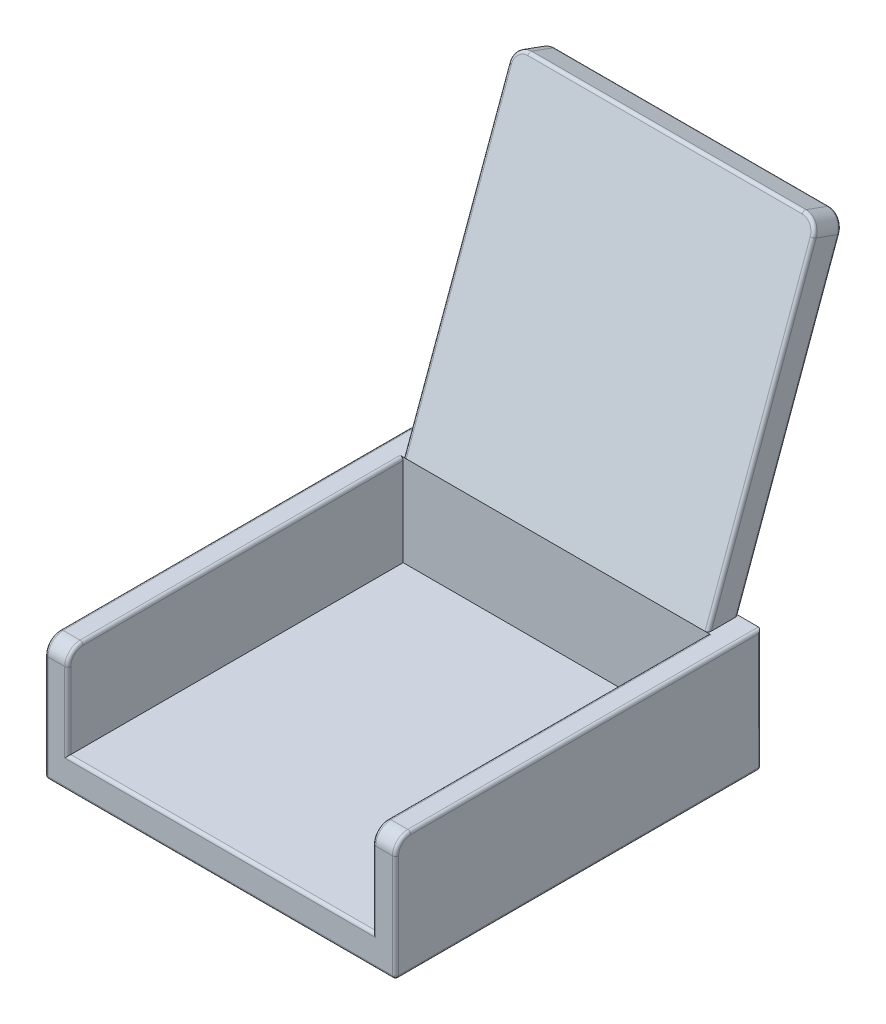
from build123d import *

# Parameters (mm, degrees)
SKETCH_1_W           = 23
SKETCH_1_H           = 24
EXTRUDE_1_DEPTH      = 8
SKETCH_2_W           = 20
SKETCH_2_H           = 22
CUT_EXTRUDE_1_DEPTH  = 6
EXTRUDE_3_DEPTH      = 10
EXTRUDE_3_DEPTH_BACK = 10
EXTRUDE_START        = -3.5
EXTRUDE_4_DEPTH      = 15
FILLET_1_R           = 1
FILLET_3_R           = 0.2
FILLET_4_R           = 0.2
FILLET_6_R           = 0.1


with BuildPart() as part:
    # 草图1 → 凸台-拉伸1 (new body)
    with BuildSketch(Plane(origin=(0, 0, 0), x_dir=(1, 0, 0), z_dir=(0, 1, 0))):
        Rectangle(SKETCH_1_W, SKETCH_1_H)
    extrude(amount=EXTRUDE_1_DEPTH)

    # 草图2 → 切除-拉伸1 (cut)
    with BuildSketch(Plane(origin=(0, 8, 0), x_dir=(1, 0, 0), z_dir=(0, 1, 0))):
        with Locations((0, -1)):
            Rectangle(SKETCH_2_W, SKETCH_2_H)
    extrude(amount=-CUT_EXTRUDE_1_DEPTH, mode=Mode.SUBTRACT)

    # 草图3 → 凸台-拉伸3 (add, two sides: drawn at the far end of the back side and taken through both)
    with BuildSketch(Plane(origin=(0, 0, 0), x_dir=(0, 0, -1), z_dir=(1, 0, 0)).offset(-EXTRUDE_3_DEPTH_BACK)):
        Polygon((12, 8), (19.011412938, 27.263698726), (17.245368495, 27.906486336), (10, 8), align=None)
    extrude(amount=EXTRUDE_3_DEPTH + EXTRUDE_3_DEPTH_BACK)

    # 草图4 → 凸台-拉伸4 (add)
    with BuildSketch(Plane.XY.offset(12).offset(EXTRUDE_START)):
        with BuildLine():
            Line((-1.5, 0), (1.5, 0))
            Line((1.5, 0), (1.5, -0.677124344))
            ThreePointArc((1.5, -0.677124344), (1.780042303, -1.088161527), (1.95, -1.555590279))
            Line((1.95, -1.555590279), (1.95, -2.5))
            Line((1.95, -2.5), (1.466025404, -2.5))
            Line((1.466025404, -2.5), (0.6, -1))
            Line((0.6, -1), (-0.6, -1))
            Line((-0.6, -1), (-1.466025404, -2.5))
            Line((-1.466025404, -2.5), (-1.95, -2.5))
            Line((-1.95, -2.5), (-1.95, -1.555590279))
            ThreePointArc((-1.95, -1.555590279), (-1.780042303, -1.088161527), (-1.5, -0.677124344))
            Line((-1.5, -0.677124344), (-1.5, 0))
        make_face()
    extrude(amount=-EXTRUDE_4_DEPTH)

    # 圆角1
    fillet_1_edges = [part.edges().sort_by_distance(p)[0] for p in [
        (-10.75, 8, 12),
        (10.75, 8, 12),
        (-10, 27.585092531, -18.128390717),
        (10, 27.585092531, -18.128390717),
    ]]
    fillet(fillet_1_edges, radius=FILLET_1_R)

    # 圆角3
    # the kernel refuses this fillet: 0.2 mm, written as the material it takes off along each edge
    with BuildSketch(Plane(origin=(-11.3, 0.2, 11.8), x_dir=(0, -1, 0), z_dir=(0, 0, 1))) as fillet_3_piece_1_section:
        Polygon((0, 0), (FILLET_3_R * 1.02, 0), (FILLET_3_R * 1.02, -FILLET_3_R * 1.02), (0, -FILLET_3_R * 1.02), align=None)
    fillet_3_piece_1 = extrude(amount=FILLET_3_R * 1.02, mode=Mode.PRIVATE)
    fillet_3_piece_1 = fillet_3_piece_1 - Plane(origin=(-11.3, 0.2, 11.8), x_dir=(0.7071067811865475, 0.7071067811865475, 0), z_dir=(0, 0, 1)) * Sphere(FILLET_3_R, mode=Mode.PRIVATE)
    add(fillet_3_piece_1, mode=Mode.SUBTRACT)
    with BuildSketch(Plane(origin=(-11.3, 0.2, -11.8), x_dir=(0, 0, -1), z_dir=(0, -1, 0))) as fillet_3_piece_2_section:
        Polygon((0, 0), (FILLET_3_R * 1.02, 0), (FILLET_3_R * 1.02, -FILLET_3_R * 1.02), (0, -FILLET_3_R * 1.02), align=None)
    fillet_3_piece_2 = extrude(amount=FILLET_3_R * 1.02, mode=Mode.PRIVATE)
    fillet_3_piece_2 = fillet_3_piece_2 - Plane(origin=(-11.3, 0.2, -11.8), x_dir=(0.7071067811865477, 0, 0.7071067811865475), z_dir=(0, -1, 0)) * Sphere(FILLET_3_R, mode=Mode.PRIVATE)
    add(fillet_3_piece_2, mode=Mode.SUBTRACT)
    with BuildSketch(Plane(origin=(11.3, 0.2, -11.8), x_dir=(0, -1, 0), z_dir=(1, 0, 0))) as fillet_3_piece_3_section:
        Polygon((0, 0), (FILLET_3_R * 1.02, 0), (FILLET_3_R * 1.02, FILLET_3_R * 1.02), (0, FILLET_3_R * 1.02), align=None)
    fillet_3_piece_3 = extrude(amount=FILLET_3_R * 1.02, mode=Mode.PRIVATE)
    fillet_3_piece_3 = fillet_3_piece_3 - Plane(origin=(11.3, 0.2, -11.8), x_dir=(0, 0.7071067811865475, 0.7071067811865475), z_dir=(1, 0, 0)) * Sphere(FILLET_3_R, mode=Mode.PRIVATE)
    add(fillet_3_piece_3, mode=Mode.SUBTRACT)
    with BuildSketch(Plane(origin=(11.3, 0.2, 11.8), x_dir=(0, 0, 1), z_dir=(1, 0, 0))) as fillet_3_piece_4_section:
        Polygon((0, 0), (FILLET_3_R * 1.02, 0), (FILLET_3_R * 1.02, FILLET_3_R * 1.02), (0, FILLET_3_R * 1.02), align=None)
    fillet_3_piece_4 = extrude(amount=FILLET_3_R * 1.02, mode=Mode.PRIVATE)
    fillet_3_piece_4 = fillet_3_piece_4 - Plane(origin=(11.3, 0.2, 11.8), x_dir=(0, 0.7071067811865475, -0.7071067811865475), z_dir=(1, 0, 0)) * Sphere(FILLET_3_R, mode=Mode.PRIVATE)
    add(fillet_3_piece_4, mode=Mode.SUBTRACT)
    with BuildSketch(Plane(origin=(-10, 8, -10), x_dir=(0, -1, 0), z_dir=(0, 0, 1))) as fillet_3_piece_5_section:
        with BuildLine():
            CenterArc((FILLET_3_R, -FILLET_3_R), FILLET_3_R, 90, 90)
            Line((0, -FILLET_3_R), (-FILLET_3_R * 0.02, -FILLET_3_R))
            Line((-FILLET_3_R * 0.02, -FILLET_3_R), (-FILLET_3_R * 0.02, FILLET_3_R * 0.02))
            Line((-FILLET_3_R * 0.02, FILLET_3_R * 0.02), (FILLET_3_R, FILLET_3_R * 0.02))
            Line((FILLET_3_R, FILLET_3_R * 0.02), (FILLET_3_R, 0))
        make_face()
    fillet_3_piece_5 = extrude(amount=21, mode=Mode.PRIVATE)
    fillet_3_piece_5 = split(fillet_3_piece_5, bisect_by=Plane(origin=(-10, 7.959305374, 0.5), z_dir=(-1, 0, 0)), keep=Keep.TOP, mode=Mode.PRIVATE)
    add(fillet_3_piece_5, mode=Mode.SUBTRACT)
    with BuildSketch(Plane(origin=(-10, 7, 11), x_dir=(0, 0, 1), z_dir=(0, -1, 0))) as fillet_3_piece_6:
        with BuildLine():
            CenterArc((1 - FILLET_3_R, FILLET_3_R), FILLET_3_R, 270, 90)
            Line((1 - FILLET_3_R, 0), (1 - FILLET_3_R, -FILLET_3_R * 0.02))
            Line((1 - FILLET_3_R, -FILLET_3_R * 0.02), (1 + FILLET_3_R * 0.02, -FILLET_3_R * 0.02))
            Line((1 + FILLET_3_R * 0.02, -FILLET_3_R * 0.02), (1 + FILLET_3_R * 0.02, FILLET_3_R))
            Line((1 + FILLET_3_R * 0.02, FILLET_3_R), (1, FILLET_3_R))
        make_face()
    revolve(axis=Axis((-10, 7, 11), (-1, 0, 0)), revolution_arc=90, mode=Mode.SUBTRACT)
    with BuildSketch(Plane(origin=(10, 8, 11), x_dir=(1, 0, 0), z_dir=(0, 0, -1))) as fillet_3_piece_7_section:
        with BuildLine():
            CenterArc((FILLET_3_R, FILLET_3_R), FILLET_3_R, 180, 90)
            Line((0, FILLET_3_R), (-FILLET_3_R * 0.02, FILLET_3_R))
            Line((-FILLET_3_R * 0.02, FILLET_3_R), (-FILLET_3_R * 0.02, -FILLET_3_R * 0.02))
            Line((-FILLET_3_R * 0.02, -FILLET_3_R * 0.02), (FILLET_3_R, -FILLET_3_R * 0.02))
            Line((FILLET_3_R, -FILLET_3_R * 0.02), (FILLET_3_R, 0))
        make_face()
    fillet_3_piece_7 = extrude(amount=21, mode=Mode.PRIVATE)
    fillet_3_piece_7 = split(fillet_3_piece_7, bisect_by=Plane(origin=(10, 7.959305374, 0.5), z_dir=(1, 0, 0)), keep=Keep.TOP, mode=Mode.PRIVATE)
    add(fillet_3_piece_7, mode=Mode.SUBTRACT)
    with BuildSketch(Plane(origin=(10, 7, 11), x_dir=(0, 0, 1), z_dir=(0, -1, 0))) as fillet_3_piece_8:
        with BuildLine():
            CenterArc((1 - FILLET_3_R, -FILLET_3_R), FILLET_3_R, 0, 90)
            Line((1 - FILLET_3_R, 0), (1 - FILLET_3_R, FILLET_3_R * 0.02))
            Line((1 - FILLET_3_R, FILLET_3_R * 0.02), (1 + FILLET_3_R * 0.02, FILLET_3_R * 0.02))
            Line((1 + FILLET_3_R * 0.02, FILLET_3_R * 0.02), (1 + FILLET_3_R * 0.02, -FILLET_3_R))
            Line((1 + FILLET_3_R * 0.02, -FILLET_3_R), (1, -FILLET_3_R))
        make_face()
    revolve(axis=Axis((10, 7, 11), (-1, 0, 0)), revolution_arc=90, mode=Mode.SUBTRACT)
    with BuildSketch(Plane(origin=(-11.5, 0, 11.8), x_dir=(1, 0, 0), z_dir=(0, 0, -1))) as fillet_3_piece_9:
        with BuildLine():
            CenterArc((FILLET_3_R, -FILLET_3_R), FILLET_3_R, 90, 90)
            Line((0, -FILLET_3_R), (-FILLET_3_R * 0.02, -FILLET_3_R))
            Line((-FILLET_3_R * 0.02, -FILLET_3_R), (-FILLET_3_R * 0.02, FILLET_3_R * 0.02))
            Line((-FILLET_3_R * 0.02, FILLET_3_R * 0.02), (FILLET_3_R, FILLET_3_R * 0.02))
            Line((FILLET_3_R, FILLET_3_R * 0.02), (FILLET_3_R, 0))
        make_face()
    extrude(amount=23.6, mode=Mode.SUBTRACT)
    with BuildSketch(Plane(origin=(-11.5, 0.2, -12), x_dir=(1, 0, 0), z_dir=(0, 1, 0)), Plane(origin=(11.5, 0.2, -12), x_dir=(0, 0, 1), z_dir=(0, 1, 0))) as fillet_3_piece_10:
        with BuildLine():
            CenterArc((FILLET_3_R, -FILLET_3_R), FILLET_3_R, 90, 90)
            Line((0, -FILLET_3_R), (-FILLET_3_R * 0.02, -FILLET_3_R))
            Line((-FILLET_3_R * 0.02, -FILLET_3_R), (-FILLET_3_R * 0.02, FILLET_3_R * 0.02))
            Line((-FILLET_3_R * 0.02, FILLET_3_R * 0.02), (FILLET_3_R, FILLET_3_R * 0.02))
            Line((FILLET_3_R, FILLET_3_R * 0.02), (FILLET_3_R, 0))
        make_face()
    extrude(amount=7.8, mode=Mode.SUBTRACT)
    with BuildSketch(Plane(origin=(-11.5, 8, 11), x_dir=(0, -1, 0), z_dir=(0, 0, -1)), Plane(origin=(11.5, 8, -12), x_dir=(0, -1, 0), z_dir=(0, 0, 1))) as fillet_3_piece_11:
        with BuildLine():
            CenterArc((FILLET_3_R, -FILLET_3_R), FILLET_3_R, 90, 90)
            Line((0, -FILLET_3_R), (-FILLET_3_R * 0.02, -FILLET_3_R))
            Line((-FILLET_3_R * 0.02, -FILLET_3_R), (-FILLET_3_R * 0.02, FILLET_3_R * 0.02))
            Line((-FILLET_3_R * 0.02, FILLET_3_R * 0.02), (FILLET_3_R, FILLET_3_R * 0.02))
            Line((FILLET_3_R, FILLET_3_R * 0.02), (FILLET_3_R, 0))
        make_face()
    extrude(amount=23, mode=Mode.SUBTRACT)
    with BuildSketch(Plane(origin=(-11.5, 7, 11), x_dir=(0, 0, 1), z_dir=(0, -1, 0))) as fillet_3_piece_12:
        with BuildLine():
            CenterArc((1 - FILLET_3_R, -FILLET_3_R), FILLET_3_R, 0, 90)
            Line((1, -FILLET_3_R), (1 + FILLET_3_R * 0.02, -FILLET_3_R))
            Line((1 + FILLET_3_R * 0.02, -FILLET_3_R), (1 + FILLET_3_R * 0.02, FILLET_3_R * 0.02))
            Line((1 + FILLET_3_R * 0.02, FILLET_3_R * 0.02), (1 - FILLET_3_R, FILLET_3_R * 0.02))
            Line((1 - FILLET_3_R, FILLET_3_R * 0.02), (1 - FILLET_3_R, 0))
        make_face()
    revolve(axis=Axis((-11.5, 7, 11), (-1, 0, 0)), revolution_arc=90, mode=Mode.SUBTRACT)
    with BuildSketch(Plane(origin=(11.5, 0, -11.8), x_dir=(0, 1, 0), z_dir=(0, 0, 1))) as fillet_3_piece_13:
        with BuildLine():
            CenterArc((FILLET_3_R, FILLET_3_R), FILLET_3_R, 180, 90)
            Line((0, FILLET_3_R), (-FILLET_3_R * 0.02, FILLET_3_R))
            Line((-FILLET_3_R * 0.02, FILLET_3_R), (-FILLET_3_R * 0.02, -FILLET_3_R * 0.02))
            Line((-FILLET_3_R * 0.02, -FILLET_3_R * 0.02), (FILLET_3_R, -FILLET_3_R * 0.02))
            Line((FILLET_3_R, -FILLET_3_R * 0.02), (FILLET_3_R, 0))
        make_face()
    extrude(amount=23.6, mode=Mode.SUBTRACT)
    with BuildSketch(Plane(origin=(11.5, 7, 11), x_dir=(0, 0, 1), z_dir=(0, -1, 0))) as fillet_3_piece_14:
        with BuildLine():
            CenterArc((1 - FILLET_3_R, FILLET_3_R), FILLET_3_R, 270, 90)
            Line((1, FILLET_3_R), (1 + FILLET_3_R * 0.02, FILLET_3_R))
            Line((1 + FILLET_3_R * 0.02, FILLET_3_R), (1 + FILLET_3_R * 0.02, -FILLET_3_R * 0.02))
            Line((1 + FILLET_3_R * 0.02, -FILLET_3_R * 0.02), (1 - FILLET_3_R, -FILLET_3_R * 0.02))
            Line((1 - FILLET_3_R, -FILLET_3_R * 0.02), (1 - FILLET_3_R, 0))
        make_face()
    revolve(axis=Axis((11.5, 7, 11), (-1, 0, 0)), revolution_arc=90, mode=Mode.SUBTRACT)
    with BuildSketch(Plane(origin=(11.3, 0, 12), x_dir=(0, 1, 0), z_dir=(-1, 0, 0))) as fillet_3_piece_15:
        with BuildLine():
            CenterArc((FILLET_3_R, FILLET_3_R), FILLET_3_R, 180, 90)
            Line((0, FILLET_3_R), (-FILLET_3_R * 0.02, FILLET_3_R))
            Line((-FILLET_3_R * 0.02, FILLET_3_R), (-FILLET_3_R * 0.02, -FILLET_3_R * 0.02))
            Line((-FILLET_3_R * 0.02, -FILLET_3_R * 0.02), (FILLET_3_R, -FILLET_3_R * 0.02))
            Line((FILLET_3_R, -FILLET_3_R * 0.02), (FILLET_3_R, 0))
        make_face()
    extrude(amount=22.6, mode=Mode.SUBTRACT)
    with BuildSketch(Plane(origin=(-11.5, 0.2, 12), x_dir=(1, 0, 0), z_dir=(0, 1, 0)), Plane(origin=(11.5, 0.2, 12), x_dir=(0, 0, -1), z_dir=(0, 1, 0))) as fillet_3_piece_16:
        with BuildLine():
            CenterArc((FILLET_3_R, FILLET_3_R), FILLET_3_R, 180, 90)
            Line((0, FILLET_3_R), (-FILLET_3_R * 0.02, FILLET_3_R))
            Line((-FILLET_3_R * 0.02, FILLET_3_R), (-FILLET_3_R * 0.02, -FILLET_3_R * 0.02))
            Line((-FILLET_3_R * 0.02, -FILLET_3_R * 0.02), (FILLET_3_R, -FILLET_3_R * 0.02))
            Line((FILLET_3_R, -FILLET_3_R * 0.02), (FILLET_3_R, 0))
        make_face()
    extrude(amount=6.8, mode=Mode.SUBTRACT)
    with BuildSketch(Plane(origin=(-10, 7, 12), x_dir=(-1, 0, 0), z_dir=(0, -1, 0))) as fillet_3_piece_17:
        with BuildLine():
            CenterArc((FILLET_3_R, FILLET_3_R), FILLET_3_R, 180, 90)
            Line((0, FILLET_3_R), (-FILLET_3_R * 0.02, FILLET_3_R))
            Line((-FILLET_3_R * 0.02, FILLET_3_R), (-FILLET_3_R * 0.02, -FILLET_3_R * 0.02))
            Line((-FILLET_3_R * 0.02, -FILLET_3_R * 0.02), (FILLET_3_R, -FILLET_3_R * 0.02))
            Line((FILLET_3_R, -FILLET_3_R * 0.02), (FILLET_3_R, 0))
        make_face()
    extrude(amount=5, mode=Mode.SUBTRACT)
    with BuildSketch(Plane(origin=(-10, 2, 12), x_dir=(0, -1, 0), z_dir=(1, 0, 0))) as fillet_3_piece_18:
        with BuildLine():
            CenterArc((FILLET_3_R, FILLET_3_R), FILLET_3_R, 180, 90)
            Line((0, FILLET_3_R), (-FILLET_3_R * 0.02, FILLET_3_R))
            Line((-FILLET_3_R * 0.02, FILLET_3_R), (-FILLET_3_R * 0.02, -FILLET_3_R * 0.02))
            Line((-FILLET_3_R * 0.02, -FILLET_3_R * 0.02), (FILLET_3_R, -FILLET_3_R * 0.02))
            Line((FILLET_3_R, -FILLET_3_R * 0.02), (FILLET_3_R, 0))
        make_face()
    extrude(amount=20, mode=Mode.SUBTRACT)
    with BuildSketch(Plane(origin=(10, 7, 12), x_dir=(1, 0, 0), z_dir=(0, -1, 0))) as fillet_3_piece_19:
        with BuildLine():
            CenterArc((FILLET_3_R, -FILLET_3_R), FILLET_3_R, 90, 90)
            Line((0, -FILLET_3_R), (-FILLET_3_R * 0.02, -FILLET_3_R))
            Line((-FILLET_3_R * 0.02, -FILLET_3_R), (-FILLET_3_R * 0.02, FILLET_3_R * 0.02))
            Line((-FILLET_3_R * 0.02, FILLET_3_R * 0.02), (FILLET_3_R, FILLET_3_R * 0.02))
            Line((FILLET_3_R, FILLET_3_R * 0.02), (FILLET_3_R, 0))
        make_face()
    extrude(amount=5, mode=Mode.SUBTRACT)
    with BuildSketch(Plane(origin=(-11.3, 0, -12), x_dir=(0, 0, 1), z_dir=(1, 0, 0))) as fillet_3_piece_20:
        with BuildLine():
            CenterArc((FILLET_3_R, -FILLET_3_R), FILLET_3_R, 90, 90)
            Line((0, -FILLET_3_R), (-FILLET_3_R * 0.02, -FILLET_3_R))
            Line((-FILLET_3_R * 0.02, -FILLET_3_R), (-FILLET_3_R * 0.02, FILLET_3_R * 0.02))
            Line((-FILLET_3_R * 0.02, FILLET_3_R * 0.02), (FILLET_3_R, FILLET_3_R * 0.02))
            Line((FILLET_3_R, FILLET_3_R * 0.02), (FILLET_3_R, 0))
        make_face()
    extrude(amount=22.6, mode=Mode.SUBTRACT)
    with BuildSketch(Plane(origin=(-11.5, 0.2, -12), x_dir=(1, 0, 0), z_dir=(0, 1, 0))) as fillet_3_piece_21a_section:
        with BuildLine():
            CenterArc((FILLET_3_R, -FILLET_3_R), FILLET_3_R, 90, 90)
            Line((0, -FILLET_3_R), (-FILLET_3_R * 0.02, -FILLET_3_R))
            Line((-FILLET_3_R * 0.02, -FILLET_3_R), (-FILLET_3_R * 0.02, FILLET_3_R * 0.02))
            Line((-FILLET_3_R * 0.02, FILLET_3_R * 0.02), (FILLET_3_R, FILLET_3_R * 0.02))
            Line((FILLET_3_R, FILLET_3_R * 0.02), (FILLET_3_R, 0))
        make_face()
    fillet_3_piece_21a = extrude(amount=8.3, mode=Mode.PRIVATE)
    fillet_3_piece_21a = split(fillet_3_piece_21a, bisect_by=Plane(origin=(-11.454720977, 8, -11.954720977), z_dir=(0, 1, 0)), keep=Keep.TOP, mode=Mode.PRIVATE)
    with BuildSketch(Plane(origin=(-11.5, 8, 11), x_dir=(0, -1, 0), z_dir=(0, 0, -1))) as fillet_3_piece_21b_section:
        with BuildLine():
            CenterArc((FILLET_3_R, -FILLET_3_R), FILLET_3_R, 90, 90)
            Line((0, -FILLET_3_R), (-FILLET_3_R * 0.02, -FILLET_3_R))
            Line((-FILLET_3_R * 0.02, -FILLET_3_R), (-FILLET_3_R * 0.02, FILLET_3_R * 0.02))
            Line((-FILLET_3_R * 0.02, FILLET_3_R * 0.02), (FILLET_3_R, FILLET_3_R * 0.02))
            Line((FILLET_3_R, FILLET_3_R * 0.02), (FILLET_3_R, 0))
        make_face()
    fillet_3_piece_21b = extrude(amount=23.5, mode=Mode.PRIVATE)
    fillet_3_piece_21b = split(fillet_3_piece_21b, bisect_by=Plane(origin=(-11.454720977, 7.954720977, -12), z_dir=(0, 0, -1)), keep=Keep.TOP, mode=Mode.PRIVATE)
    fillet_3_piece_21 = fillet_3_piece_21a & fillet_3_piece_21b
    add(fillet_3_piece_21, mode=Mode.SUBTRACT)
    with BuildSketch(Plane(origin=(11.5, 8, -12.5), x_dir=(0, -1, 0), z_dir=(0, 0, 1))) as fillet_3_piece_22a_section:
        with BuildLine():
            CenterArc((FILLET_3_R, -FILLET_3_R), FILLET_3_R, 90, 90)
            Line((0, -FILLET_3_R), (-FILLET_3_R * 0.02, -FILLET_3_R))
            Line((-FILLET_3_R * 0.02, -FILLET_3_R), (-FILLET_3_R * 0.02, FILLET_3_R * 0.02))
            Line((-FILLET_3_R * 0.02, FILLET_3_R * 0.02), (FILLET_3_R, FILLET_3_R * 0.02))
            Line((FILLET_3_R, FILLET_3_R * 0.02), (FILLET_3_R, 0))
        make_face()
    fillet_3_piece_22a = extrude(amount=23.5, mode=Mode.PRIVATE)
    fillet_3_piece_22a = split(fillet_3_piece_22a, bisect_by=Plane(origin=(11.454720977, 7.954720977, -12), z_dir=(0, 0, -1)), keep=Keep.TOP, mode=Mode.PRIVATE)
    with BuildSketch(Plane(origin=(11.5, 0.2, -12), x_dir=(0, 0, 1), z_dir=(0, 1, 0))) as fillet_3_piece_22b_section:
        with BuildLine():
            CenterArc((FILLET_3_R, -FILLET_3_R), FILLET_3_R, 90, 90)
            Line((0, -FILLET_3_R), (-FILLET_3_R * 0.02, -FILLET_3_R))
            Line((-FILLET_3_R * 0.02, -FILLET_3_R), (-FILLET_3_R * 0.02, FILLET_3_R * 0.02))
            Line((-FILLET_3_R * 0.02, FILLET_3_R * 0.02), (FILLET_3_R, FILLET_3_R * 0.02))
            Line((FILLET_3_R, FILLET_3_R * 0.02), (FILLET_3_R, 0))
        make_face()
    fillet_3_piece_22b = extrude(amount=8.3, mode=Mode.PRIVATE)
    fillet_3_piece_22b = split(fillet_3_piece_22b, bisect_by=Plane(origin=(11.454720977, 8, -11.954720977), z_dir=(0, 1, 0)), keep=Keep.TOP, mode=Mode.PRIVATE)
    fillet_3_piece_22 = fillet_3_piece_22a & fillet_3_piece_22b
    add(fillet_3_piece_22, mode=Mode.SUBTRACT)
    with BuildSketch(Plane(origin=(-10, 7, 12), x_dir=(-1, 0, 0), z_dir=(0, -1, 0))) as fillet_3_piece_23a_section:
        with BuildLine():
            CenterArc((FILLET_3_R, FILLET_3_R), FILLET_3_R, 180, 90)
            Line((0, FILLET_3_R), (-FILLET_3_R * 0.02, FILLET_3_R))
            Line((-FILLET_3_R * 0.02, FILLET_3_R), (-FILLET_3_R * 0.02, -FILLET_3_R * 0.02))
            Line((-FILLET_3_R * 0.02, -FILLET_3_R * 0.02), (FILLET_3_R, -FILLET_3_R * 0.02))
            Line((FILLET_3_R, -FILLET_3_R * 0.02), (FILLET_3_R, 0))
        make_face()
    fillet_3_piece_23a = extrude(amount=5.5, mode=Mode.PRIVATE)
    fillet_3_piece_23a = split(fillet_3_piece_23a, bisect_by=Plane(origin=(-10.045279023, 2, 11.954720977), z_dir=(0, -1, 0)), keep=Keep.TOP, mode=Mode.PRIVATE)
    with BuildSketch(Plane(origin=(-10.5, 2, 12), x_dir=(0, -1, 0), z_dir=(1, 0, 0))) as fillet_3_piece_23b_section:
        with BuildLine():
            CenterArc((FILLET_3_R, FILLET_3_R), FILLET_3_R, 180, 90)
            Line((0, FILLET_3_R), (-FILLET_3_R * 0.02, FILLET_3_R))
            Line((-FILLET_3_R * 0.02, FILLET_3_R), (-FILLET_3_R * 0.02, -FILLET_3_R * 0.02))
            Line((-FILLET_3_R * 0.02, -FILLET_3_R * 0.02), (FILLET_3_R, -FILLET_3_R * 0.02))
            Line((FILLET_3_R, -FILLET_3_R * 0.02), (FILLET_3_R, 0))
        make_face()
    fillet_3_piece_23b = extrude(amount=20.5, mode=Mode.PRIVATE)
    fillet_3_piece_23b = split(fillet_3_piece_23b, bisect_by=Plane(origin=(-10, 1.954720977, 11.954720977), z_dir=(-1, 0, 0)), keep=Keep.TOP, mode=Mode.PRIVATE)
    fillet_3_piece_23 = fillet_3_piece_23a & fillet_3_piece_23b
    add(fillet_3_piece_23, mode=Mode.SUBTRACT)
    with BuildSketch(Plane(origin=(-10, 2, 12), x_dir=(0, -1, 0), z_dir=(1, 0, 0))) as fillet_3_piece_24a_section:
        with BuildLine():
            CenterArc((FILLET_3_R, FILLET_3_R), FILLET_3_R, 180, 90)
            Line((0, FILLET_3_R), (-FILLET_3_R * 0.02, FILLET_3_R))
            Line((-FILLET_3_R * 0.02, FILLET_3_R), (-FILLET_3_R * 0.02, -FILLET_3_R * 0.02))
            Line((-FILLET_3_R * 0.02, -FILLET_3_R * 0.02), (FILLET_3_R, -FILLET_3_R * 0.02))
            Line((FILLET_3_R, -FILLET_3_R * 0.02), (FILLET_3_R, 0))
        make_face()
    fillet_3_piece_24a = extrude(amount=20.5, mode=Mode.PRIVATE)
    fillet_3_piece_24a = split(fillet_3_piece_24a, bisect_by=Plane(origin=(10, 1.954720977, 11.954720977), z_dir=(1, 0, 0)), keep=Keep.TOP, mode=Mode.PRIVATE)
    with BuildSketch(Plane(origin=(10, 7, 12), x_dir=(1, 0, 0), z_dir=(0, -1, 0))) as fillet_3_piece_24b_section:
        with BuildLine():
            CenterArc((FILLET_3_R, -FILLET_3_R), FILLET_3_R, 90, 90)
            Line((0, -FILLET_3_R), (-FILLET_3_R * 0.02, -FILLET_3_R))
            Line((-FILLET_3_R * 0.02, -FILLET_3_R), (-FILLET_3_R * 0.02, FILLET_3_R * 0.02))
            Line((-FILLET_3_R * 0.02, FILLET_3_R * 0.02), (FILLET_3_R, FILLET_3_R * 0.02))
            Line((FILLET_3_R, FILLET_3_R * 0.02), (FILLET_3_R, 0))
        make_face()
    fillet_3_piece_24b = extrude(amount=5.5, mode=Mode.PRIVATE)
    fillet_3_piece_24b = split(fillet_3_piece_24b, bisect_by=Plane(origin=(10.045279023, 2, 11.954720977), z_dir=(0, -1, 0)), keep=Keep.TOP, mode=Mode.PRIVATE)
    fillet_3_piece_24 = fillet_3_piece_24a & fillet_3_piece_24b
    add(fillet_3_piece_24, mode=Mode.SUBTRACT)

    # 圆角4
    fillet_4_edges = [part.edges().sort_by_distance(p)[0] for p in [
        (-10, 17.162003053, -15.334696397),
        (-9.707106781, 26.98846913, -18.911237557),
        (0, 27.263698726, -19.011412938),
        (9.707106781, 26.98846913, -18.911237557),
        (-10, 17.483396858, -13.451674176),
        (-9.707106781, 27.631256739, -17.145193114),
        (0, 27.906486336, -17.245368495),
        (9.707106781, 27.631256739, -17.145193114),
        (10, 17.162003053, -15.334696397),
        (10, 17.483396858, -13.451674176),
    ]]
    fillet(fillet_4_edges, radius=FILLET_4_R)

    # 圆角6
    fillet_6_edges = [part.edges().sort_by_distance(p)[0] for p in [
        (1.466025404, -2.5, 1),
        (-1.708012702, -2.5, -6.5),
        (-1.466025404, -2.5, 1),
        (-1.95, -2.5, 1),
        (1.708012702, -2.5, -6.5),
        (1.95, -2.5, 1),
        (1.708012702, -2.5, 8.5),
        (-1.708012702, -2.5, 8.5),
    ]]
    fillet(fillet_6_edges, radius=FILLET_6_R)


solid = part.part
